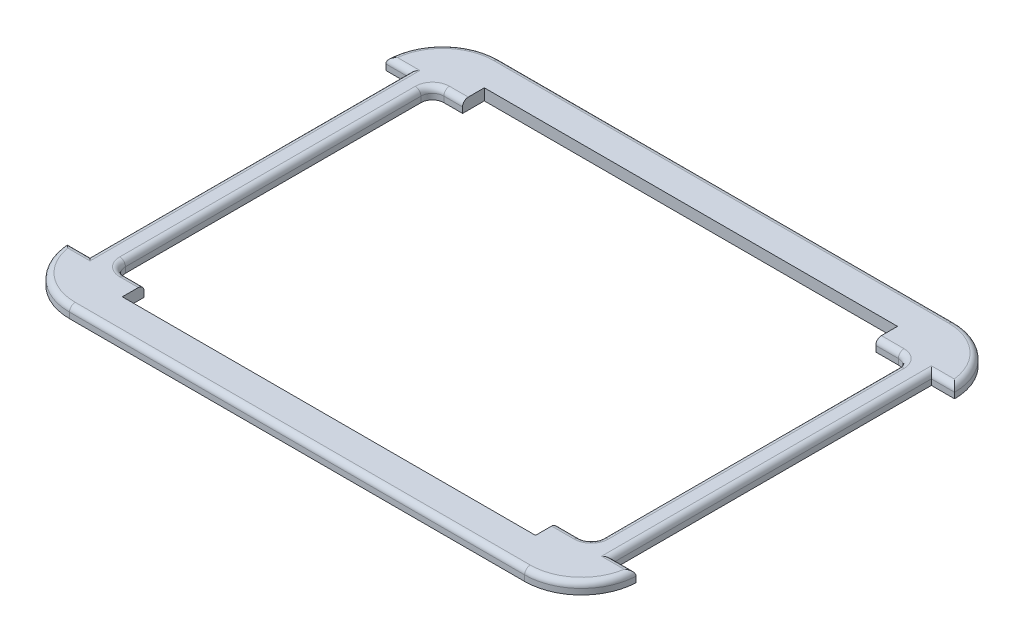
from build123d import *

# Parameters (mm, degrees)
BOSS_EXTRUDE1_DEPTH = 1
FILLET1_R           = 5
FILLET2_R           = 0.5


with BuildPart() as part:
    # Sketch1 → Boss-Extrude1 (new body)
    with BuildSketch(Plane(origin=(0, 0, 0), x_dir=(1, 0, 0), z_dir=(0, 1, 0))):
        Polygon((-25, -18.9), (25, -18.9), (25, -14.1), (22.96, -14.1), (22.96, 13.9), (25, 13.9), (25, 18.9), (-25, 18.9), (-25, 13.9), (-23, 13.9), (-23, -14.1), (-25, -14.1), align=None)
        with BuildLine():
            Line((-18.351, 15.911365238), (17.970976359, 15.911365238))
            Line((17.970976359, 15.911365238), (17.971, 14))
            Line((17.971, 14), (19.96, 14))
            ThreePointArc((19.96, 14), (20.667106781, 13.707106781), (20.96, 13))
            Line((20.96, 13), (20.96, -13))
            ThreePointArc((20.96, -13), (20.667106781, -13.707106781), (19.96, -14))
            Line((19.96, -14), (17.971, -14))
            Line((17.971, -14), (17.971, -15.911365238))
            Line((17.971, -15.911365238), (-18.351, -15.911365238))
            Line((-18.351, -15.911365238), (-18.351, -14))
            Line((-18.351, -14), (-20, -14))
            ThreePointArc((-20, -14), (-20.711257423, -13.702939741), (-21, -12.988265238))
            Line((-21, -12.988265238), (-21, 12.988265238))
            ThreePointArc((-21, 12.988265238), (-20.711254501, 13.702936852), (-20, 14))
            Line((-20, 14), (-18.351, 14))
            Line((-18.351, 14), (-18.351, 15.911365238))
        make_face(mode=Mode.SUBTRACT)
    extrude(amount=BOSS_EXTRUDE1_DEPTH)

    # Fillet1
    # the kernel refuses this fillet: 5 mm, written as the material it takes off along each edge
    with BuildSketch(Plane(origin=(25, -12.489995997, 18.9), x_dir=(-1, 0, 0), z_dir=(0, 1, 0))) as fillet1_piece_1:
        with BuildLine():
            CenterArc((4.995998399, -5), FILLET1_R, 90, 87.707557224)
            Line((0, -4.8), (-0.099919968, -4.796))
            ThreePointArc((-0.099919968, -4.796), (-0.1, -2.4), (-0.1, 0))
            Line((-0.1, 0), (0, 0.1))
            Line((0, 0.1), (4.995998399, 0.1))
            Line((4.995998399, 0.1), (4.995998399, 0))
        make_face()
    extrude(amount=25.979991994, mode=Mode.SUBTRACT)
    with BuildSketch(Plane(origin=(-25, -12.489995997, 18.9), x_dir=(1, 0, 0), z_dir=(0, 1, 0))) as fillet1_piece_2:
        with BuildLine():
            CenterArc((4.995998399, 5), FILLET1_R, 182.292442776, 87.707557224)
            Line((0, 4.8), (-0.099919968, 4.796))
            ThreePointArc((-0.099919968, 4.796), (-0.1, 2.4), (-0.1, 0))
            Line((-0.1, 0), (0, -0.1))
            Line((0, -0.1), (4.995998399, -0.1))
            Line((4.995998399, -0.1), (4.995998399, 0))
        make_face()
    extrude(amount=25.979991994, mode=Mode.SUBTRACT)
    with BuildSketch(Plane(origin=(-25, -12.5, -18.9), x_dir=(1, 0, 0), z_dir=(0, 1, 0)), Plane(origin=(25, -12.5, -18.9), x_dir=(0, 0, 1), z_dir=(0, 1, 0))) as fillet1_piece_3:
        with BuildLine():
            CenterArc((FILLET1_R, -FILLET1_R), FILLET1_R, 90, 90)
            Line((0, -FILLET1_R), (-FILLET1_R * 0.02, -FILLET1_R))
            Line((-FILLET1_R * 0.02, -FILLET1_R), (-FILLET1_R * 0.02, FILLET1_R * 0.02))
            Line((-FILLET1_R * 0.02, FILLET1_R * 0.02), (FILLET1_R, FILLET1_R * 0.02))
            Line((FILLET1_R, FILLET1_R * 0.02), (FILLET1_R, 0))
        make_face()
    extrude(amount=26, mode=Mode.SUBTRACT)

    # Fillet2
    fillet2_edges = [part.edges().sort_by_distance(p)[0] for p in [
        (-24, 1, -13.9),
        (-23, 1, 0.1),
        (-24, 1, 14.1),
        (23.98, 1, 14.1),
        (22.96, 1, 0.1),
        (23.98, 1, -13.9),
        (-19.1755, 1, -14),
        (-20.711254501, 1, -13.702936852),
        (-21, 1, 0),
        (-20.711257423, 1, 13.702939741),
        (-19.1755, 1, 14),
        (18.9655, 1, 14),
        (20.667106781, 1, 13.707106781),
        (20.96, 1, 0),
        (20.667106781, 1, -13.707106781),
        (18.9655, 1, -14),
        (0, 1, -18.9),
        (0, 1, 18.9),
        (-23.468103216, 1, 17.505551275),
        (23.468103216, 1, 17.505551275),
        (23.535533906, 1, -17.435533906),
        (-23.535533906, 1, -17.435533906),
    ]]
    fillet(fillet2_edges, radius=FILLET2_R)


solid = part.part
